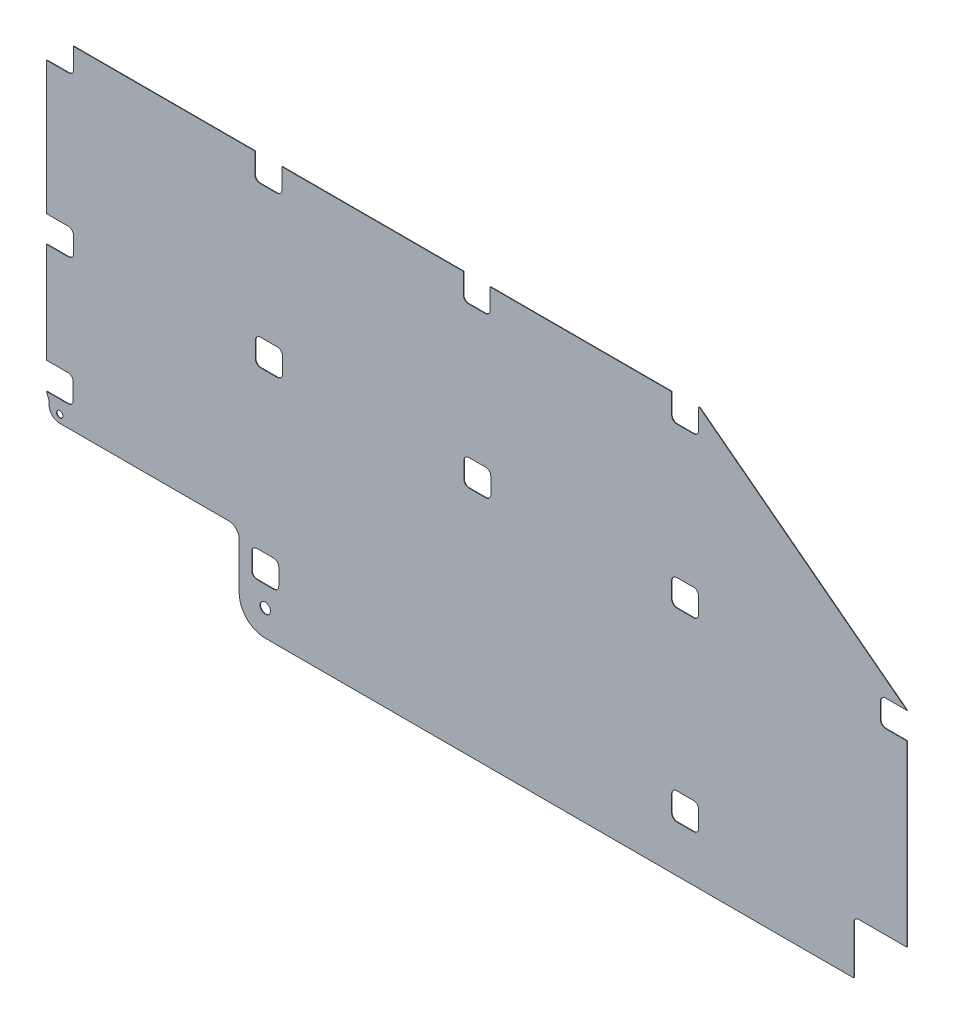
from build123d import *

# Parameters (mm, degrees)
CROQUIS1_W            = 1652
CROQUIS1_H            = 800
BRIDA_BASE1_DEPTH     = 1
CROQUIS14_W           = 51.8
CROQUIS14_H           = 50.8
CROQUIS14_W_2         = 50.8
CORTAR_EXTRUIR1_DEPTH = 1219.148680595
REDONDEO1_R           = 10
REDONDEO2_R           = 10
CROQUIS17_W           = 370
CROQUIS17_H           = 160
CROQUIS17_W_2         = 5
CROQUIS17_H_2         = 30
CROQUIS17_R           = 6.1
CORTAR_EXTRUIR2_DEPTH = 10
REDONDEO3_R           = 50
REDONDEO4_R           = 20
CROQUIS18_R           = 10
CROQUIS18_W           = 51.8
CROQUIS18_H           = 51.8
CROQUIS18_W_2         = 102.1
CROQUIS18_H_2         = 102.1
CORTAR_EXTRUIR3_DEPTH = 10
REDONDEO5_R           = 10
REDONDEO6_R           = 20
REDONDEO7_R           = 10


# Sheet-metal steps are written as plain solids
with BuildPart() as part:
    # Brida base1: sheet metal written as solids
    # Croquis1 → Brida base1 (new body)
    with BuildSketch(Plane.XY):
        with Locations((191.278244715, -270.097142857)):
            Rectangle(CROQUIS1_W, CROQUIS1_H)
    extrude(amount=-BRIDA_BASE1_DEPTH)

    # Croquis14 → Cortar-Extruir1 (cut, through all)
    with BuildSketch(Plane.XY.offset(-1)):
        with Locations((-608.821755285, -199.597142857)):
            Rectangle(CROQUIS14_W, CROQUIS14_H)
        with Locations((991.878244715, -199.597142857)):
            Rectangle(CROQUIS14_W_2, CROQUIS14_H)
        with Locations((591.378244715, -199.597142857)):
            Rectangle(CROQUIS14_W, CROQUIS14_H)
        Polygon((617.278244715, 81.002857143), (617.278244715, 131.802857143), (565.478244715, 131.802857143), (565.478244715, 81.002857143), (591.378244715, 81.002857143), align=None)
        Polygon((617.278244715, 131.802857143), (1017.278244715, -174.197142857), (1017.278244715, 131.802857143), align=None)
        with Locations((-207.621755285, -199.597142857)):
            Rectangle(CROQUIS14_W, CROQUIS14_H)
        with Locations((192.378244715, -199.597142857)):
            Rectangle(CROQUIS14_W, CROQUIS14_H)
        with Locations((191.311578048, 106.402857143)):
            Rectangle(CROQUIS14_W, CROQUIS14_H)
        with Locations((-208.755088618, 106.402857143)):
            Rectangle(CROQUIS14_W, CROQUIS14_H)
        with Locations((-608.821755285, 106.402857143)):
            Rectangle(CROQUIS14_W, CROQUIS14_H)
    extrude(amount=CORTAR_EXTRUIR1_DEPTH, mode=Mode.SUBTRACT)

    # Redondeo1
    redondeo1_edges = [part.edges().sort_by_distance(p)[0] for p in [
        (617.278244715, -224.997142857, -0.5),
    ]]
    fillet(redondeo1_edges, radius=REDONDEO1_R)

    # Redondeo2
    redondeo2_edges = [part.edges().sort_by_distance(p)[0] for p in [
        (-582.921755285, -174.197142857, -0.5),
        (-582.921755285, -224.997142857, -0.5),
        (-181.721755285, -174.197142857, -0.5),
        (-233.521755285, -174.197142857, -0.5),
        (-233.521755285, -224.997142857, -0.5),
        (-181.721755285, -224.997142857, -0.5),
        (166.478244715, -174.197142857, -0.5),
        (166.478244715, -224.997142857, -0.5),
        (218.278244715, -224.997142857, -0.5),
        (218.278244715, -174.197142857, -0.5),
        (617.278244715, -174.197142857, -0.5),
        (565.478244715, -174.197142857, -0.5),
        (565.478244715, -224.997142857, -0.5),
        (966.478244715, -224.997142857, -0.5),
        (966.478244715, -174.197142857, -0.5),
        (565.478244715, 81.002857143, -0.5),
        (617.278244715, 81.002857143, -0.5),
        (-582.921755285, 81.002857143, -0.5),
        (-234.655088618, 81.002857143, -0.5),
        (-182.855088618, 81.002857143, -0.5),
        (165.411578048, 81.002857143, -0.5),
        (217.211578048, 81.002857143, -0.5),
    ]]
    fillet(redondeo2_edges, radius=REDONDEO2_R)

    # Croquis17 → Cortar-Extruir2 (cut)
    with BuildSketch(Plane(origin=(0, 0, -1), x_dir=(-1, 0, 0), z_dir=(0, 0, -1))):
        with Locations((449.721755285, -590.097142857)):
            Rectangle(CROQUIS17_W, CROQUIS17_H)
        with Locations((632.221755285, -495.097142857)):
            Rectangle(CROQUIS17_W_2, CROQUIS17_H_2)
        with Locations((609.321755285, -495.097142857)):
            Circle(CROQUIS17_R)
    extrude(amount=-CORTAR_EXTRUIR2_DEPTH, mode=Mode.SUBTRACT)

    # Redondeo3
    redondeo3_edges = [part.edges().sort_by_distance(p)[0] for p in [
        (-264.721755285, -670.097142857, -0.5),
        (1017.278244715, -670.097142857, -0.5),
    ]]
    fillet(redondeo3_edges, radius=REDONDEO3_R)

    # Redondeo4
    # the kernel refuses this fillet: 20 mm, written as the material it adds along each edge
    with BuildSketch(Plane(origin=(-264.721755285, -510.097142857, -1), x_dir=(0, -1, 0), z_dir=(0, 0, 1))) as redondeo4_piece_1:
        with BuildLine():
            CenterArc((REDONDEO4_R, -REDONDEO4_R), REDONDEO4_R, 90, 90)
            Line((0, -REDONDEO4_R), (0, 0))
            Line((0, 0), (REDONDEO4_R, 0))
        make_face()
    extrude(amount=1)
    # the kernel refuses this fillet: 20 mm, written as the material it takes off along each edge
    with BuildSketch(Plane(origin=(-629.721755285, -510.097142857, -51), x_dir=(1, 0, 0), z_dir=(0, 0, 1))) as redondeo4_2_piece_1:
        with BuildLine():
            CenterArc((REDONDEO4_R, REDONDEO4_R), REDONDEO4_R, 180, 90)
            Line((0, REDONDEO4_R), (0, 0))
            Line((0, 0), (REDONDEO4_R, 0))
        make_face()
    extrude(amount=101, mode=Mode.SUBTRACT)
    with BuildSketch(Plane(origin=(-634.721755285, -480.097142857, -34.071891388), x_dir=(1, 0, 0), z_dir=(0, 0, 1))) as redondeo4_2_piece_2:
        with BuildLine():
            CenterArc((20, 13.228756555), REDONDEO4_R, 180, 41.409622109)
            Line((0, 13.228756555), (0, 0))
            Line((0, 0), (5, 0))
        make_face()
    extrude(amount=67.143782777, mode=Mode.SUBTRACT)

    # Croquis18 → Cortar-Extruir3 (cut)
    with BuildSketch(Plane(origin=(0, 0, -1), x_dir=(-1, 0, 0), z_dir=(0, 0, -1))):
        with Locations((214.721755285, -620.097142857)):
            Circle(CROQUIS18_R)
        with Locations((609.321755285, -443.737142857)):
            Rectangle(CROQUIS18_W, CROQUIS18_H)
        with Locations((-591.378244715, -554.697142857)):
            Rectangle(CROQUIS18_W, CROQUIS18_H)
        with Locations((-966.228244715, -619.047142857)):
            Rectangle(CROQUIS18_W_2, CROQUIS18_H_2)
        with Locations((214.721755285, -554.697142857)):
            Rectangle(CROQUIS18_W, CROQUIS18_H)
    extrude(amount=-CORTAR_EXTRUIR3_DEPTH, mode=Mode.SUBTRACT)

    # Redondeo5
    redondeo5_edges = [part.edges().sort_by_distance(p)[0] for p in [
        (565.478244715, -528.797142857, -0.5),
        (565.478244715, -580.597142857, -0.5),
        (617.278244715, -580.597142857, -0.5),
        (617.278244715, -528.797142857, -0.5),
        (915.178244715, -567.997142857, -0.5),
        (-188.821755285, -528.797142857, -0.5),
        (-240.621755285, -528.797142857, -0.5),
        (-240.621755285, -580.597142857, -0.5),
        (-188.821755285, -580.597142857, -0.5),
    ]]
    fillet(redondeo5_edges, radius=REDONDEO5_R)

    # Redondeo6
    redondeo6_edges = [part.edges().sort_by_distance(p)[0] for p in [
        (-629.721755285, -480.097142857, -0.5),
    ]]
    fillet(redondeo6_edges, radius=REDONDEO6_R)

    # Redondeo7
    redondeo7_edges = [part.edges().sort_by_distance(p)[0] for p in [
        (-583.421755285, -469.637142857, -0.5),
        (-583.421755285, -417.837142857, -0.5),
    ]]
    fillet(redondeo7_edges, radius=REDONDEO7_R)


solid = part.part
